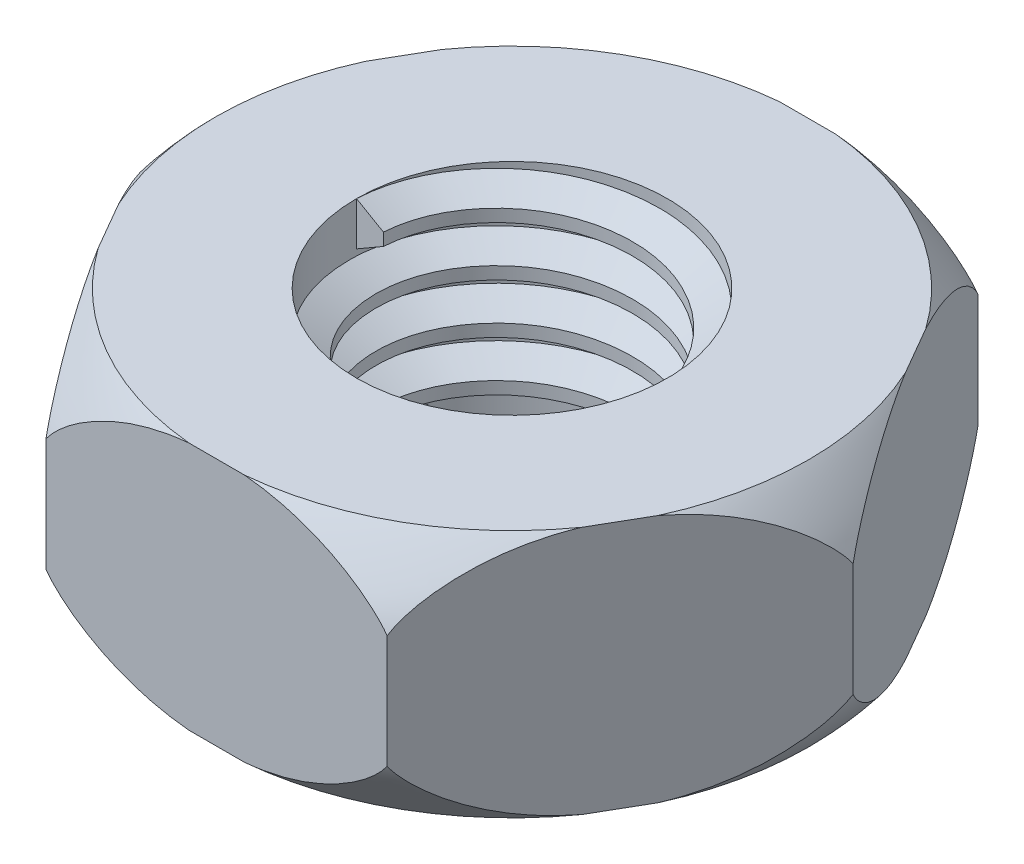
from build123d import *

# Parameters (mm, degrees)
SKETCH1_R           = 2.5
BOSS_EXTRUDE1_DEPTH = 2
THREAD1_PITCH       = 0.8
SCALE1_SCALE        = 0.6


with BuildPart() as part:
    # Sketch1 → Boss-Extrude1 (new body)
    with BuildSketch(Plane(origin=(0, 0, 0), x_dir=(1, 0, 0), z_dir=(0, 1, 0))):
        Polygon((-5.484827557, 0), (-2.742413779, -4.75), (2.742413779, -4.75), (5.484827557, 0), (2.742413779, 4.75), (-2.742413779, 4.75), align=None)
        with Locations(Location((0, 0, 0), (0, 0, 270))):
            Circle(SKETCH1_R, mode=Mode.SUBTRACT)
    boss_extrude1 = extrude(amount=-BOSS_EXTRUDE1_DEPTH)

    # Sketch2 → Cut-Revolve1 (revolve, cut)
    with BuildSketch(Plane.XY):
        with BuildLine():
            Line((-5.484827557, -0.910278043), (-5.484827557, -2))
            Line((-5.484827557, -2), (-4.771038843, -2))
            add(Edge.make_bspline(
                [(-4.771038843, -2), (-4.976393344, -1.791145905), (-5.342339128, -1.305644769), (-5.484827557, -0.910278043)],
                knots=[0, 0, 0, 0, 0.941596052, 0.941596052, 0.941596052, 0.941596052], degree=3))
        make_face()
    cut_revolve1 = revolve(axis=Axis((0, 0, 0), (0, -1, 0)), mode=Mode.SUBTRACT)

    # Mirror2: Boss-Extrude1, Cut-Revolve1 across plane
    add(boss_extrude1.mirror(Plane.ZX))
    add(cut_revolve1.mirror(Plane.ZX), mode=Mode.SUBTRACT)

    # Thread1: arcs per turn and ends read off the stored shape
    # Thread1: the profile of Thread Profile1 profile screwed along a right-hand helix through 4.0625 turns, 8 arcs to a turn; built about Z, then put on its axis
    thread1_z = Axis((0, 0, 0), (0, 0, 1))
    thread1_corners = [(2.5003, 0, -0.000173205), (2.5003, 0, 0.700173203), (2.0669873, 0, 0.449999999), (2.0669873, 0, 0.249999999)]
    with BuildLine(mode=Mode.PRIVATE) as thread1_profile:
        Line(thread1_corners[0], thread1_corners[1])
        Line(thread1_corners[1], thread1_corners[2])
        Line(thread1_corners[2], thread1_corners[3])
        Line(thread1_corners[3], thread1_corners[0])
    thread1_cap = Face(thread1_profile.wire())
    thread1_turn_angles = [0, 22.5, 45, 67.5, 90, 112.5, 135, 157.5, 180, 202.5, 225, 247.5, 270, 292.5, 315, 337.5, 360]
    thread1_turn_weights = [1, 0.9238795325112867, 1, 0.9238795325112867, 1, 0.9238795325112867, 1, 0.9238795325112867, 1, 0.9238795325112867, 1, 0.9238795325112867, 1, 0.9238795325112867, 1, 0.9238795325112867, 1]
    thread1_turn_rails = [Edge.make_bspline([Vector(p[0], p[1], 0).rotate(thread1_z, thread1_turn_angles[k]) / thread1_turn_weights[k] + Vector(0, 0, p[2] + THREAD1_PITCH * thread1_turn_angles[k] / 360) for k in range(17)], [0, 0, 0, 1, 1, 2, 2, 3, 3, 4, 4, 5, 5, 6, 6, 7, 7, 8, 8, 8], 2, thread1_turn_weights) for p in thread1_corners]
    thread1_turn_sides = [Face.make_surface_from_curves(thread1_turn_rails[p[0]], thread1_turn_rails[p[1]]) for p in [(0, 1), (1, 2), (2, 3), (3, 0)]]
    thread1_last_angles = [1440, 1451.25, 1462.5]
    thread1_last_weights = [1, 0.9807852804032304, 1]
    thread1_last_rails = [Edge.make_bspline([Vector(p[0], p[1], 0).rotate(thread1_z, thread1_last_angles[k]) / thread1_last_weights[k] + Vector(0, 0, p[2] + THREAD1_PITCH * thread1_last_angles[k] / 360) for k in range(3)], [0, 0, 0, 1, 1, 1], 2, thread1_last_weights) for p in thread1_corners]
    thread1_last_sides = [Face.make_surface_from_curves(thread1_last_rails[p[0]], thread1_last_rails[p[1]]) for p in [(0, 1), (1, 2), (2, 3), (3, 0)]]
    thread1 = Plane(origin=(0, 2, 0), x_dir=(-1, 0, 0), z_dir=(0, -1, 0)) * Solid(Shell([*[p.moved(Location((0, 0, THREAD1_PITCH * i))) for i in range(4) for p in thread1_turn_sides], *thread1_last_sides, thread1_cap, thread1_cap.rotate(thread1_z, 1462.5).moved(Location((0, 0, THREAD1_PITCH * 1462.5 / 360)))]))
    add(thread1)


with BuildPart() as part_1:
    # Scale1: scaled about (-0.002142501, 0.001208069, -0.000379545)
    add(part.part.scale(SCALE1_SCALE).moved(Location((-0.000857, 0.000483228, -0.000151818))))


solid = part_1.part
